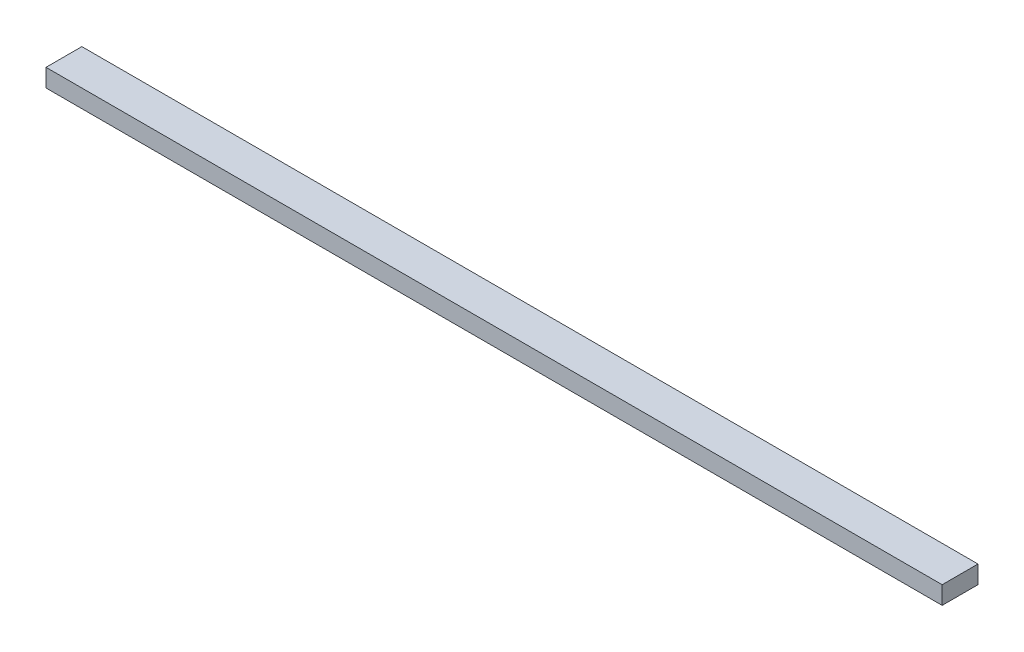
from build123d import *

# Parameters (mm, degrees)
SKETCH_1_W      = 250
SKETCH_1_H      = 10
EXTRUDE_1_DEPTH = 5


with BuildPart() as part:
    # 草图1 → 凸台-拉伸1 (new body)
    with BuildSketch(Plane(origin=(0, 0, 0), x_dir=(1, 0, 0), z_dir=(0, 1, 0))):
        with Locations((32.889874395, 1.217636835)):
            Rectangle(SKETCH_1_W, SKETCH_1_H)
    extrude(amount=EXTRUDE_1_DEPTH)


solid = part.part
